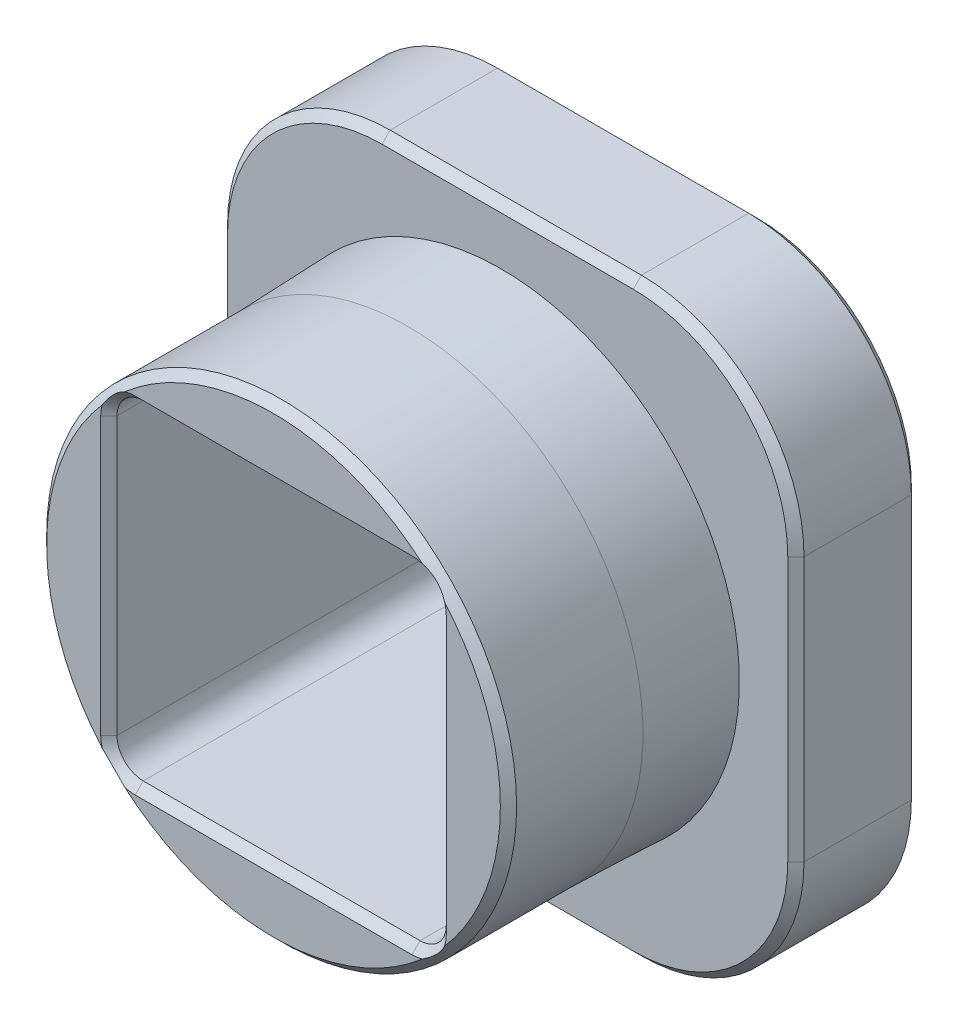
from build123d import *

# Parameters (mm, degrees)
SKETCH1_R           = 14.45
BOSS_EXTRUDE1_DEPTH = 14
BOSS_EXTRUDE2_START = 7.6
SKETCH2_W           = 35.45
SKETCH2_H           = 36.25
BOSS_EXTRUDE2_DEPTH = 7.6
FILLET1_R           = 10
CUT_EXTRUDE1_REACH  = 44.204
SKETCH3_R           = 2.3
CHAMFER1_SIZE       = 0.5
CHAMFER2_SIZE       = 0.2
CHAMFER2_SIZE2      = 5.727250657
CHAMFER3_SIZE       = 0.5


with BuildPart() as part:
    # Sketch1 → Boss-Extrude1 (new body)
    with BuildSketch(Plane.XY):
        Circle(SKETCH1_R)
        with BuildLine():
            Line((-8.510102807, -10.125), (8.510102807, -10.125))
            ThreePointArc((8.510102807, -10.125), (9.652007563, -9.652007563), (10.125, -8.510102807))
            Line((10.125, -8.510102807), (10.125, 8.510102807))
            ThreePointArc((10.125, 8.510102807), (9.652007563, 9.652007563), (8.510102807, 10.125))
            Line((8.510102807, 10.125), (-8.510102807, 10.125))
            ThreePointArc((-8.510102807, 10.125), (-9.652007563, 9.652007563), (-10.125, 8.510102807))
            Line((-10.125, 8.510102807), (-10.125, -8.510102807))
            ThreePointArc((-10.125, -8.510102807), (-9.652007563, -9.652007563), (-8.510102807, -10.125))
        make_face(mode=Mode.SUBTRACT)
    extrude(amount=BOSS_EXTRUDE1_DEPTH)

    # Sketch2 → Boss-Extrude2 (add)
    with BuildSketch(Plane(origin=(0, 0, 0), x_dir=(-1, 0, 0), z_dir=(0, 0, -1)).offset(BOSS_EXTRUDE2_START)):
        with Locations((-0.4, 0)):
            Rectangle(SKETCH2_W, SKETCH2_H)
        with BuildLine():
            Line((8.510102807, -10.125), (-8.510102807, -10.125))
            ThreePointArc((-8.510102807, -10.125), (-9.652007563, -9.652007563), (-10.125, -8.510102807))
            Line((-10.125, -8.510102807), (-10.125, 8.510102807))
            ThreePointArc((-10.125, 8.510102807), (-9.652007563, 9.652007563), (-8.510102807, 10.125))
            Line((-8.510102807, 10.125), (8.510102807, 10.125))
            ThreePointArc((8.510102807, 10.125), (9.652007563, 9.652007563), (10.125, 8.510102807))
            Line((10.125, 8.510102807), (10.125, -8.510102807))
            ThreePointArc((10.125, -8.510102807), (9.652007563, -9.652007563), (8.510102807, -10.125))
        make_face(mode=Mode.SUBTRACT)
    extrude(amount=-BOSS_EXTRUDE2_DEPTH)

    # Fillet1
    fillet1_edges = [part.edges().sort_by_distance(p)[0] for p in [
        (18.125, 18.125, -3.8),
        (18.125, -18.125, -3.8),
        (-17.325, -18.125, -3.8),
        (-17.325, 18.125, -3.8),
    ]]
    fillet(fillet1_edges, radius=FILLET1_R)

    # Sketch3 → Cut-Extrude1 (cut, up to next)
    with BuildSketch(Plane.ZY.offset(17.325), mode=Mode.PRIVATE) as cut_extrude1_sk1:
        with Locations(Location((-3.8, 0, 0), (0, 0, 270))):
            Circle(SKETCH3_R)
    cut_extrude1_tool1 = extrude(cut_extrude1_sk1.sketch, amount=-CUT_EXTRUDE1_REACH, mode=Mode.PRIVATE) & part.part
    add(cut_extrude1_tool1.solids().sort_by_distance((-17.325, 0, -3.8))[0], mode=Mode.SUBTRACT)

    # Chamfer1
    chamfer1_edges = [part.edges().sort_by_distance(p)[0] for p in [
        (-9.652007563, 9.652007563, -7.6),
        (0, 10.125, -7.6),
        (9.652007563, 9.652007563, -7.6),
        (10.125, 0, -7.6),
        (9.652007563, -9.652007563, -7.6),
        (0, -10.125, -7.6),
        (-9.652007563, -9.652007563, -7.6),
        (-10.125, 0, -7.6),
        (0.4, 18.125, 0),
        (0.4, 18.125, -7.6),
        (18.125, 0, 0),
        (-17.325, 0, 0),
        (0.4, -18.125, 0),
        (-14.396067812, -15.196067812, 0),
        (15.196067812, -15.196067812, 0),
        (15.196067812, 15.196067812, 0),
        (-14.396067812, 15.196067812, 0),
        (-17.325, 0, -7.6),
        (18.125, 0, -7.6),
        (0.4, -18.125, -7.6),
        (-14.396067812, -15.196067812, -7.6),
        (15.196067812, -15.196067812, -7.6),
        (15.196067812, 15.196067812, -7.6),
        (-14.396067812, 15.196067812, -7.6),
        (-10.125, 2.3, -3.8),
        (-17.325, 2.3, -3.8),
    ]]
    chamfer(chamfer1_edges, length=CHAMFER1_SIZE)

    # Chamfer2
    chamfer2_edges = [part.edges().sort_by_distance(p)[0] for p in [
        (-14.45, 0, 0),
    ]]
    chamfer2_side = [part.faces().sort_by_distance(p)[0] for p in [
        (0.4, 17.132114111, 0),
    ]]
    chamfer(chamfer2_edges, length=CHAMFER2_SIZE, length2=CHAMFER2_SIZE2, reference=chamfer2_side[0])

    # Chamfer3
    # the kernel refuses this chamfer: 0.5 mm, written as the material it takes off along each edge
    with BuildSketch(Plane(origin=(8.510102807, -8.510102807, 14), x_dir=(0, -1, 0), z_dir=(-1, 0, 0))) as chamfer3_piece_1:
        Polygon((1.614897193 + CHAMFER3_SIZE, 0), (1.614897193, -CHAMFER3_SIZE), (1.614897193, 0), align=None)
    revolve(axis=Axis((8.510102807, -8.510102807, 14), (0, 0, 1)), revolution_arc=90, mode=Mode.SUBTRACT)
    with BuildSketch(Plane(origin=(10.125, -8.510102807, 14), x_dir=(0.9996219169112968, 2.0865614307067877e-15, 0.027495876610585647), z_dir=(0, 1, 0)), Plane(origin=(8.510102807, 10.125, 14), x_dir=(-1.877905287636107e-15, 0.9996219169112968, 0.027495876610585647), z_dir=(-1, 0, 0)), Plane(origin=(-10.125, 8.510102807, 14), x_dir=(-0.9996219169112968, 0, 0.027495876610585647), z_dir=(0, -1, 0)), Plane(origin=(-8.510102807, -10.125, 14), x_dir=(0, -0.9996219169112968, 0.027495876610585647), z_dir=(1, 0, 0))) as chamfer3_piece_2:
        Polygon((CHAMFER3_SIZE * 0.999621916911, CHAMFER3_SIZE * 0.0274958766106), (-CHAMFER3_SIZE * 0.0274958766106, CHAMFER3_SIZE * 0.999621916911), (0, 0), align=None)
    extrude(amount=17.020205615, mode=Mode.SUBTRACT)
    with BuildSketch(Plane(origin=(8.510102807, 8.510102807, 14), x_dir=(1, 0, 0), z_dir=(0, -1, 0))) as chamfer3_piece_3:
        Polygon((1.614897193 + CHAMFER3_SIZE, 0), (1.614897193, -CHAMFER3_SIZE), (1.614897193, 0), align=None)
    revolve(axis=Axis((8.510102807, 8.510102807, 14), (0, 0, 1)), revolution_arc=90, mode=Mode.SUBTRACT)
    with BuildSketch(Plane(origin=(-8.510102807, 8.510102807, 14), x_dir=(0, 1, 0), z_dir=(1, 0, 0))) as chamfer3_piece_4:
        Polygon((1.614897193 + CHAMFER3_SIZE, 0), (1.614897193, -CHAMFER3_SIZE), (1.614897193, 0), align=None)
    revolve(axis=Axis((-8.510102807, 8.510102807, 14), (0, 0, 1)), revolution_arc=90, mode=Mode.SUBTRACT)
    with BuildSketch(Plane(origin=(-8.510102807, -8.510102807, 14), x_dir=(-1, 0, 0), z_dir=(0, 1, 0))) as chamfer3_piece_5:
        Polygon((1.614897193 + CHAMFER3_SIZE, 0), (1.614897193, -CHAMFER3_SIZE), (1.614897193, 0), align=None)
    revolve(axis=Axis((-8.510102807, -8.510102807, 14), (0, 0, 1)), revolution_arc=90, mode=Mode.SUBTRACT)
    with BuildSketch(Plane(origin=(0, 0, 14), x_dir=(1, 0, 0), z_dir=(0, -1, 0))) as chamfer3_piece_6:
        Polygon((14.45, -CHAMFER3_SIZE), (14.45 - CHAMFER3_SIZE, 0), (14.45, 0), align=None)
    revolve(axis=Axis((0, 0, 14), (0, 0, 1)), mode=Mode.SUBTRACT)


solid = part.part
